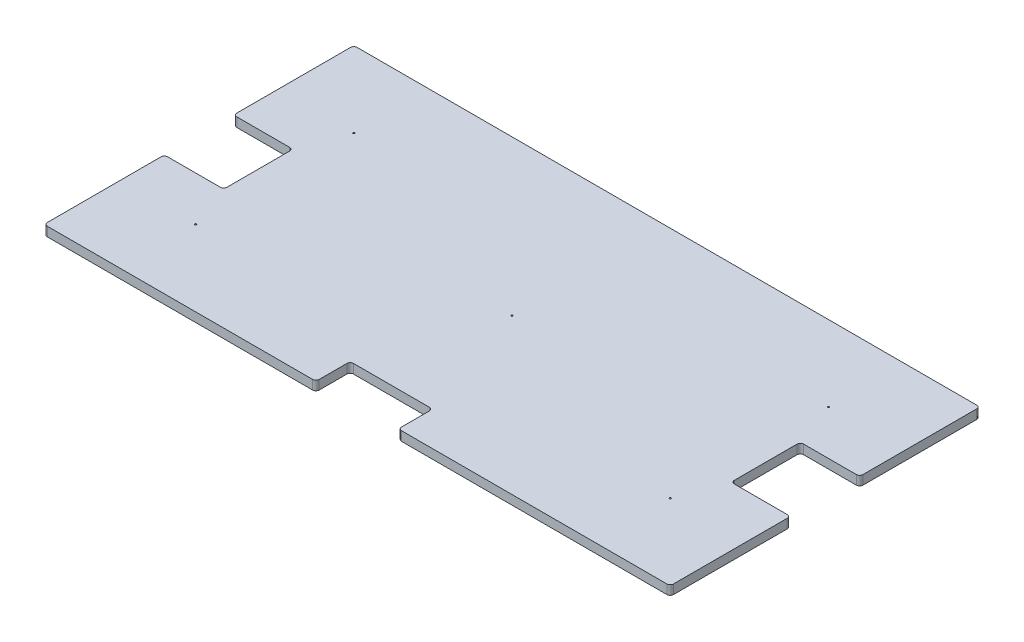
from build123d import *

# Parameters (mm, degrees)
SKETCH1_W                    = 1206.5
SKETCH1_H                    = 596.9
BOSS_EXTRUDE1_DEPTH          = 17.78
F_1_8_0_125_DIAMETER_HOLE1_D = 3.175
FILLET1_R                    = 6.35
SKETCH4_W                    = 158.75
SKETCH4_H                    = 66.04
SKETCH4_W_2                  = 114.3
SKETCH4_H_2                  = 133.35
CUT_EXTRUDE1_DEPTH           = 674.274901805
FILLET2_R                    = 6.35


with BuildPart() as part:
    # Sketch1 → Boss-Extrude1 (new body)
    with BuildSketch(Plane(origin=(0, 0, 0), x_dir=(1, 0, 0), z_dir=(0, 1, 0))):
        Rectangle(SKETCH1_W, SKETCH1_H)
    extrude(amount=BOSS_EXTRUDE1_DEPTH)

    # 1/8 (0.125) Diameter Hole1 (through all)
    with Locations(Plane(origin=(0, 17.78, 0), x_dir=(1, 0, 0), z_dir=(0, 1, 0))):
        with Locations((0, 0), (457.2, 152.4), (-457.2, -152.4), (-457.2, 152.4), (457.2, -152.4)):
            Hole(F_1_8_0_125_DIAMETER_HOLE1_D / 2)

    # Fillet1
    fillet1_edges = [part.edges().sort_by_distance(p)[0] for p in [
        (603.25, 8.89, -298.45),
        (603.25, 8.89, 298.45),
        (-603.25, 8.89, 298.45),
        (-603.25, 8.89, -298.45),
    ]]
    fillet(fillet1_edges, radius=FILLET1_R)

    # Sketch4 → Cut-Extrude1 (cut, through all)
    with BuildSketch(Plane(origin=(0, 17.78, 0), x_dir=(1, 0, 0), z_dir=(0, 1, 0))):
        with Locations((0, -265.43)):
            Rectangle(SKETCH4_W, SKETCH4_H)
        with Locations((-546.1, 0)):
            Rectangle(SKETCH4_W_2, SKETCH4_H_2)
        with Locations((546.1, 0)):
            Rectangle(SKETCH4_W_2, SKETCH4_H_2)
    extrude(amount=-CUT_EXTRUDE1_DEPTH, mode=Mode.SUBTRACT)

    # Fillet2
    fillet2_edges = [part.edges().sort_by_distance(p)[0] for p in [
        (79.375, 8.89, 298.45),
        (-79.375, 8.89, 298.45),
        (-79.375, 8.89, 232.41),
        (79.375, 8.89, 232.41),
        (-603.25, 8.89, 66.675),
        (-603.25, 8.89, -66.675),
        (-488.95, 8.89, 66.675),
        (-488.95, 8.89, -66.675),
        (603.25, 8.89, 66.675),
        (488.95, 8.89, 66.675),
        (488.95, 8.89, -66.675),
        (603.25, 8.89, -66.675),
    ]]
    fillet(fillet2_edges, radius=FILLET2_R)


solid = part.part
